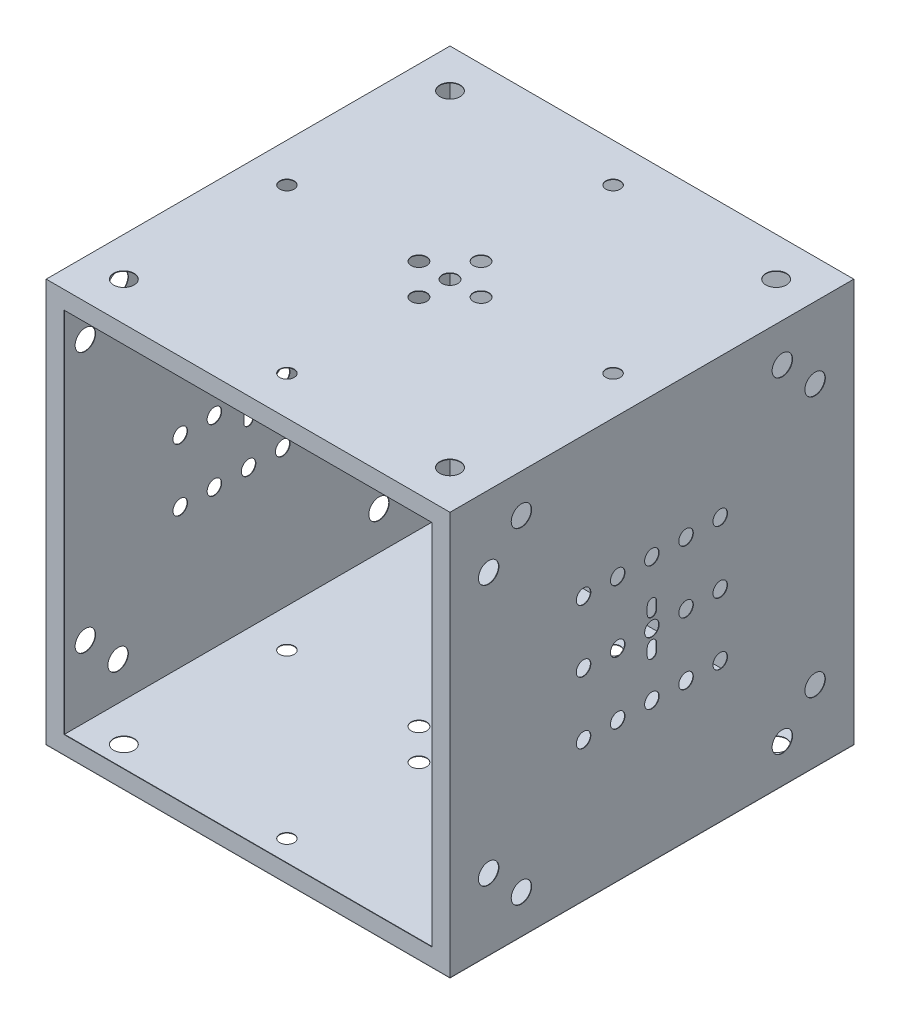
from build123d import *

# Parameters (mm, degrees)
SKETCH1_W           = 2600
SKETCH1_H           = 2600
BOSS_EXTRUDE1_DEPTH = 2597
SHELL1_T            = -3
SKETCH3_W           = 2600
SKETCH3_H           = 2597
SKETCH3_W_2         = 2370
SKETCH3_H_2         = 2367
BOSS_EXTRUDE2_DEPTH = 3
SKETCH4_R           = 49.85
SKETCH4_R_2         = 46.75
SKETCH4_R_3         = 65.8
CUT_EXTRUDE1_DEPTH  = 3182.887647294
SKETCH5_R           = 91.2
SKETCH5_R_2         = 35.635
SKETCH5_R_3         = 65.8
CUT_EXTRUDE2_DEPTH  = 3899.000641354
SKETCH6_R           = 46.75
SKETCH6_R_2         = 65.8
CUT_EXTRUDE3_DEPTH  = 3899.000641354


with BuildPart() as part:
    # Sketch1 → Boss-Extrude1 (new body)
    with BuildSketch(Plane(origin=(0, 0, 0), x_dir=(1, 0, 0), z_dir=(0, 1, 0))):
        Rectangle(SKETCH1_W, SKETCH1_H)
    extrude(amount=BOSS_EXTRUDE1_DEPTH)

    # Shell1
    shell1_openings = [part.faces().sort_by_distance(p)[0] for p in [
        (0, 1298.5, 1300),
    ]]
    offset(amount=SHELL1_T, openings=shell1_openings, kind=Kind.INTERSECTION)

    # Sketch3 → Boss-Extrude2 (add)
    with BuildSketch(Plane.XY.offset(1300)):
        with Locations((0, 1298.5)):
            Rectangle(SKETCH3_W, SKETCH3_H)
        with Locations((0, 1298.5)):
            Rectangle(SKETCH3_W_2, SKETCH3_H_2, mode=Mode.SUBTRACT)
    extrude(amount=-BOSS_EXTRUDE2_DEPTH)

    # Sketch4 → Cut-Extrude1 (cut, through all)
    with BuildSketch(Plane(origin=(0, 2597, 0), x_dir=(1, 0, 0), z_dir=(0, 1, 0))):
        Circle(SKETCH4_R)
        with Locations((0, 200)):
            Circle(SKETCH4_R)
        with Locations((0, 1050)):
            Circle(SKETCH4_R_2)
        with Locations((1050, 1050)):
            Circle(SKETCH4_R_3)
        with Locations((200, 0)):
            Circle(SKETCH4_R)
        with Locations((1050, 0)):
            Circle(SKETCH4_R_2)
        with Locations((1050, -1050)):
            Circle(SKETCH4_R_3)
        with Locations((0, -200)):
            Circle(SKETCH4_R)
        with Locations((0, -1050)):
            Circle(SKETCH4_R_2)
        with Locations((-1050, -1050)):
            Circle(SKETCH4_R_3)
        with Locations((-1050, 0)):
            Circle(SKETCH4_R_2)
        with Locations((-200, 0)):
            Circle(SKETCH4_R)
        with Locations((-1050, 1050)):
            Circle(SKETCH4_R_3)
    extrude(amount=-CUT_EXTRUDE1_DEPTH, mode=Mode.SUBTRACT)

    # Sketch5 → Cut-Extrude2 (cut, through all)
    with BuildSketch(Plane(origin=(0, 0, -1300), x_dir=(-1, 0, 0), z_dir=(0, 0, -1))):
        with Locations((0, 1298.5)):
            Circle(SKETCH5_R)
        with Locations((0, 1438.5)):
            Circle(SKETCH5_R_2)
        with Locations((-222, 1680.5)):
            Circle(SKETCH5_R)
        with Locations((222, 916.5)):
            Circle(SKETCH5_R)
        with Locations((-900, 2197.461538462)):
            Circle(SKETCH5_R_3)
        with Locations((0, 1158.5)):
            Circle(SKETCH5_R_2)
        with Locations((-900, 399.538461538)):
            Circle(SKETCH5_R_3)
        with Locations((900, 399.538461538)):
            Circle(SKETCH5_R_3)
        with Locations((900, 2197.461538462)):
            Circle(SKETCH5_R_3)
    extrude(amount=-CUT_EXTRUDE2_DEPTH, mode=Mode.SUBTRACT)

    # Sketch6 → Cut-Extrude3 (cut, through all)
    with BuildSketch(Plane.ZY.offset(1300)):
        with Locations((0, 1298.5)):
            Circle(SKETCH6_R)
        with Locations((0, 1698.5)):
            Circle(SKETCH6_R)
        with Locations((-220, 1698.5)):
            Circle(SKETCH6_R)
        with Locations((-220, 1298.5)):
            Circle(SKETCH6_R)
        with Locations((-440, 1698.5)):
            Circle(SKETCH6_R)
        with Locations((-440, 1298.5)):
            Circle(SKETCH6_R)
        with Locations((-840, 2348.5)):
            Circle(SKETCH6_R_2)
        with Locations((-1050.971331376, 2137.284394601)):
            Circle(SKETCH6_R_2)
        with Locations((220, 1298.5)):
            Circle(SKETCH6_R)
        with Locations((440, 1298.5)):
            Circle(SKETCH6_R)
        with Locations((440, 1698.5)):
            Circle(SKETCH6_R)
        with Locations((220, 1698.5)):
            Circle(SKETCH6_R)
        with Locations((1050.971331376, 2137.284394601)):
            Circle(SKETCH6_R_2)
        with Locations((840, 2348.5)):
            Circle(SKETCH6_R_2)
        with Locations((-440, 898.5)):
            Circle(SKETCH6_R)
        with Locations((-220, 898.5)):
            Circle(SKETCH6_R)
        with Locations((0, 898.5)):
            Circle(SKETCH6_R)
        with Locations((220, 898.5)):
            Circle(SKETCH6_R)
        with Locations((440, 898.5)):
            Circle(SKETCH6_R)
        with Locations((1050.971331376, 459.715605399)):
            Circle(SKETCH6_R_2)
        with Locations((840, 248.5)):
            Circle(SKETCH6_R_2)
        with Locations((-840, 248.5)):
            Circle(SKETCH6_R_2)
        with Locations((-1050.971331376, 459.715605399)):
            Circle(SKETCH6_R_2)
        with BuildLine():
            Line((30, 1438.5), (30, 1391))
            ThreePointArc((30, 1391), (0, 1361), (-30, 1391))
            Line((-30, 1391), (-30, 1438.5))
            ThreePointArc((-30, 1438.5), (0, 1468.5), (30, 1438.5))
        make_face()
        with BuildLine():
            Line((30, 1158.5), (30, 1206))
            ThreePointArc((30, 1206), (0, 1236), (-30, 1206))
            Line((-30, 1206), (-30, 1158.5))
            ThreePointArc((-30, 1158.5), (0, 1128.5), (30, 1158.5))
        make_face()
    extrude(amount=-CUT_EXTRUDE3_DEPTH, mode=Mode.SUBTRACT)


with BuildPart() as body_2:
    # Split1: the piece on the far side of the plane
    add(part.part)
    split(bisect_by=Plane.ZX.offset(3), keep=Keep.BOTTOM)


with BuildPart() as part_1:
    add(part.part)

    # Split1
    split(bisect_by=Plane.ZX.offset(3), keep=Keep.TOP)


solid = Compound([body_2.part, part_1.part])
